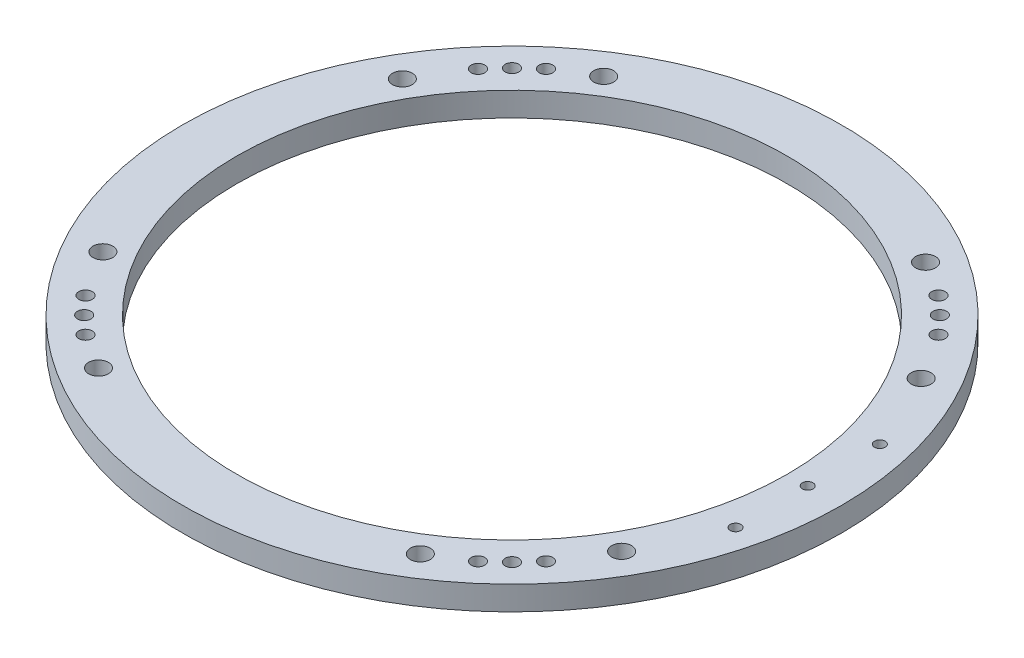
from build123d import *

# Parameters (mm, degrees)
F_9_32_0_28125_DIAMETER_HOLE1_D = 7.14375
CIRPATTERN1_COUNT               = 4
F_10_CLEARANCE_HOLE1_D          = 5.6134
Z_0_413_DIAMETER_HOLE1_D        = 10.4902


with BuildPart() as part:
    # Sketch1 → Revolve1 (revolve)
    with BuildSketch(Plane.XY):
        Polygon((145.526233777, 1064.895), (145.526233777, 1052.195), (152.4, 1052.195), (174.101233777, 1052.195), (174.101233777, 1064.895), align=None)
    revolve(axis=Axis((0, 1125.81516809, 0), (0, -1, 0)))

    # 9/32 (0.28125) Diameter Hole1 (through all)
    with Locations(Plane(origin=(0, 1052.195, 0), x_dir=(-1, 0, 0), z_dir=(0, -1, 0))):
        with Locations((103.667734326, 121.628246568), (121.628246568, 103.667734326), (113.00537488, 113.00537488)):
            f_9_32_0_28125_diameter_hole1 = Hole(F_9_32_0_28125_DIAMETER_HOLE1_D / 2)

    # CirPattern1: 9/32 (0.28125) Diameter Hole1 ×4 about axis
    cirpattern1_axis = Axis((0, 1125.81516809, 0), (0, 1, 0))
    for i in range(1, CIRPATTERN1_COUNT):
        add(f_9_32_0_28125_diameter_hole1.rotate(cirpattern1_axis, i * 360 / CIRPATTERN1_COUNT), mode=Mode.SUBTRACT)

    # #10 Clearance Hole1 (through all)
    with Locations(Plane(origin=(0, 1064.895, 0), x_dir=(1, 0, 0), z_dir=(0, 1, 0))):
        with Locations((156.21, 38.1), (156.21, 0), (156.21, -38.1)):
            Hole(F_10_CLEARANCE_HOLE1_D / 2)

    # Z (0.413) Diameter Hole1 (through all)
    with Locations(Plane(origin=(0, 1064.895, 0), x_dir=(1, 0, 0), z_dir=(0, 1, 0))):
        with Locations((-137.027937996, -79.113116888), (137.027937996, -79.113116888), (137.027937996, 79.113116888), (-137.027937996, 79.113116888), (-85.014893438, 133.44665207), (85.014893438, 133.44665207), (85.014893438, -133.44665207), (-85.014893438, -133.44665207)):
            Hole(Z_0_413_DIAMETER_HOLE1_D / 2)


solid = part.part
